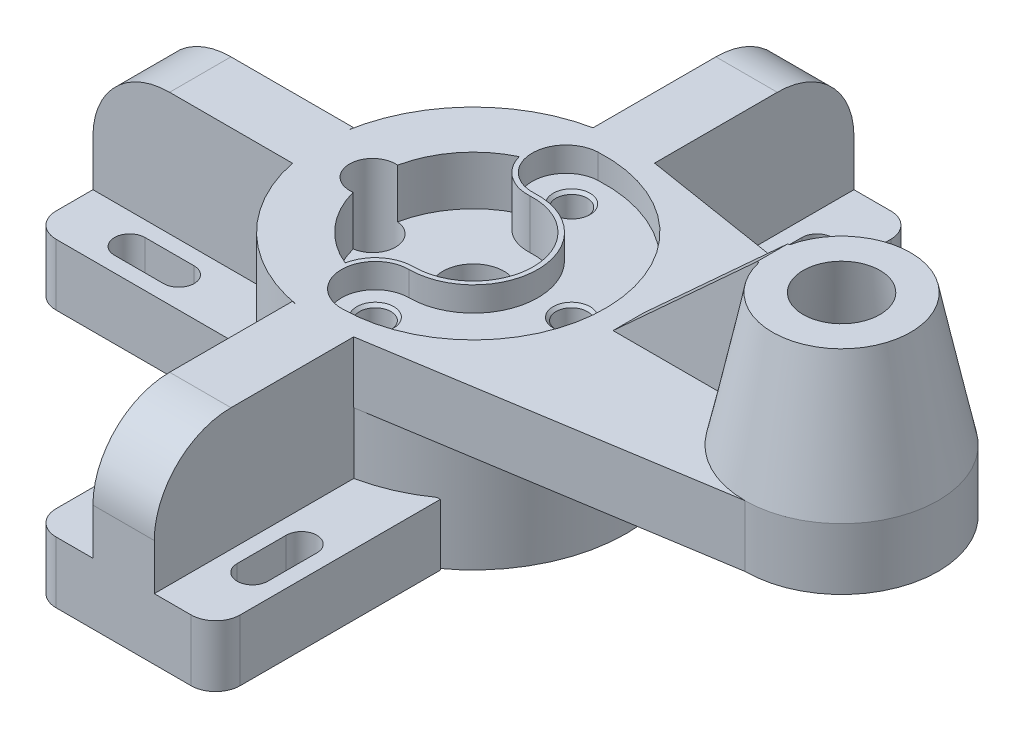
from build123d import *

# Parameters (mm, degrees)
BOSS_EXTRUDE1_DEPTH      = 20
BOSS_EXTRUDE2_START      = 40
SKETCH3_R                = 50
BOSS_EXTRUDE2_DEPTH      = 40
BOSS_EXTRUDE3_START      = -40
BOSS_EXTRUDE3_DEPTH      = 40
FILLET1_R                = 25
CIRPATTERN1_COUNT        = 2
CIRPATTERN1_ANGLE        = 90
FILLET1_OF_CIRPATTERN1_R = 25
CIRPATTERN2_COUNT        = 2
FILLET1_OF_CIRPATTERN2_R = 25
BOSS_EXTRUDE4_START      = 20
BOSS_EXTRUDE4_DEPTH      = 20
FILLET2_R                = 8
FILLET3_R                = 8
CUT_EXTRUDE1_DEPTH       = 264.396788984
CIRPATTERN4_COUNT        = 2
CIRPATTERN4_ANGLE        = 180
CIRPATTERN4_COPY_1_DEPTH = 264.396788984
FILLET4_R                = 8
FILLET5_R                = 8
CIRPATTERN6_COUNT        = 2
CIRPATTERN6_ANGLE        = 270
CIRPATTERN6_COPY_1_DEPTH = 264.396788984
FILLET6_R                = 8
FILLET7_R                = 8
CUT_EXTRUDE2_DEPTH       = 8
CIRPATTERN7_COUNT        = 3
CIRPATTERN7_ANGLE        = 180
CUT_EXTRUDE3_DEPTH       = 16
SKETCH21_R               = 7.5
CUT_EXTRUDE4_DEPTH       = 268.16636848
SKETCH22_R               = 10
CUT_EXTRUDE5_DEPTH       = 267.943567929


with BuildPart() as part:
    # Sketch2 → Boss-Extrude1 (new body)
    with BuildSketch(Plane(origin=(0, 0, 0), x_dir=(1, 0, 0), z_dir=(0, 1, 0))):
        with BuildLine():
            Line((-112.127978028, 49.376424233), (0, 31.5))
            ThreePointArc((0, 31.5), (31.5, 0), (0, -31.5))
            Line((0, -31.5), (-112.127978028, -49.376424233))
            ThreePointArc((-112.127978028, -49.376424233), (-170, 0), (-112.127978028, 49.376424233))
        make_face()
    extrude(amount=BOSS_EXTRUDE1_DEPTH)

    # Sketch3 → Boss-Extrude2 (add)
    with BuildSketch(Plane.XZ.offset(BOSS_EXTRUDE2_START)):
        with Locations(Location((-120, 0, 0), (0, 0, 270))):
            Circle(SKETCH3_R)
    extrude(amount=-BOSS_EXTRUDE2_DEPTH)

    # Sketch5 → Boss-Extrude3 (add)
    with BuildSketch(Plane(origin=(0, 20, 0), x_dir=(1, 0, 0), z_dir=(0, 1, 0)).offset(BOSS_EXTRUDE3_START)):
        with BuildLine():
            Line((-130, 114.03716334), (-130, 48.989794856))
            ThreePointArc((-130, 48.989794856), (-121.081407967, 49.9883042), (-112.127978028, 49.376424233))
            Line((-112.127978028, 49.376424233), (-110, 49.03716334))
            Line((-110, 49.03716334), (-110, 114.03716334))
            Line((-110, 114.03716334), (-130, 114.03716334))
        make_face()
    boss_extrude3 = extrude(amount=BOSS_EXTRUDE3_DEPTH)

    # Fillet1
    fillet1_edges = [part.edges().sort_by_distance(p)[0] for p in [
        (-120, 20, -114.03716334),
    ]]
    fillet(fillet1_edges, radius=FILLET1_R)

    # CirPattern1: Boss-Extrude3 ×2 about axis
    cirpattern1_axis = Axis((-120, 0, 0), (0, 1, 0))
    for i in range(1, CIRPATTERN1_COUNT):
        add(boss_extrude3.rotate(cirpattern1_axis, i * CIRPATTERN1_ANGLE / (CIRPATTERN1_COUNT - 1)))

    # Fillet1 of CirPattern1
    fillet1_of_cirpattern1_edges = [part.edges().sort_by_distance(p)[0] for p in [
        (-234.03716334, 20, 0),
    ]]
    fillet(fillet1_of_cirpattern1_edges, radius=FILLET1_OF_CIRPATTERN1_R)

    # CirPattern2: Boss-Extrude3 ×2 about axis
    cirpattern2_axis = Axis((-120, 0, 0), (0, 1, 0))
    for i in range(1, CIRPATTERN2_COUNT):
        add(boss_extrude3.rotate(cirpattern2_axis, i * 360 / CIRPATTERN2_COUNT))

    # Fillet1 of CirPattern2
    fillet1_of_cirpattern2_edges = [part.edges().sort_by_distance(p)[0] for p in [
        (-120, 20, 114.03716334),
    ]]
    fillet(fillet1_of_cirpattern2_edges, radius=FILLET1_OF_CIRPATTERN2_R)

    # Sketch6 → Boss-Extrude4 (add)
    with BuildSketch(Plane.XZ.offset(20).offset(BOSS_EXTRUDE4_START)):
        with BuildLine():
            ThreePointArc((-110, 48.989794856), (-100.123850776, 45.879610853), (-91.100082802, 40.801896842))
            Line((-91.100082802, 40.801896842), (-90, 40.801896842))
            Line((-90, 40.801896842), (-90, 114.03716334))
            Line((-90, 114.03716334), (-110, 114.03716334))
            Line((-110, 114.03716334), (-110, 48.989794856))
        make_face()
        with BuildLine():
            ThreePointArc((-120, 50), (-114.9745519, 49.74680765), (-110, 48.989794856))
            Line((-110, 48.989794856), (-110, 114.03716334))
            Line((-110, 114.03716334), (-120, 114.03716334))
            Line((-120, 114.03716334), (-120, 50))
        make_face()
        with BuildLine():
            Line((-130, 49.03716334), (-127.872021972, 49.376424233))
            ThreePointArc((-127.872021972, 49.376424233), (-123.948340685, 49.843862268), (-120, 50))
            Line((-120, 50), (-120, 114.03716334))
            Line((-120, 114.03716334), (-130, 114.03716334))
            Line((-130, 114.03716334), (-130, 49.03716334))
        make_face()
        with BuildLine():
            Line((-150, 40.801896842), (-148.899917198, 40.801896842))
            ThreePointArc((-148.899917198, 40.801896842), (-138.879208341, 46.298763401), (-127.872021972, 49.376424233))
            Line((-127.872021972, 49.376424233), (-130, 49.03716334))
            Line((-130, 49.03716334), (-130, 114.03716334))
            Line((-130, 114.03716334), (-150, 114.03716334))
            Line((-150, 114.03716334), (-150, 40.801896842))
        make_face()
    boss_extrude4 = extrude(amount=-BOSS_EXTRUDE4_DEPTH)

    # Fillet2
    fillet2_edges = [part.edges().sort_by_distance(p)[0] for p in [
        (-150, -30, 114.03716334),
    ]]
    fillet(fillet2_edges, radius=FILLET2_R)

    # Fillet3
    fillet3_edges = [part.edges().sort_by_distance(p)[0] for p in [
        (-90, -30, 114.03716334),
    ]]
    fillet(fillet3_edges, radius=FILLET3_R)

    # Sketch8 → Cut-Extrude1 (cut, through all)
    with BuildSketch(Plane(origin=(0, -20, 0), x_dir=(1, 0, 0), z_dir=(0, 1, 0))):
        with BuildLine():
            Line((-95, -76.03716334), (-95, -92.03716334))
            ThreePointArc((-95, -92.03716334), (-100, -97.03716334), (-105, -92.03716334))
            Line((-105, -92.03716334), (-105, -76.03716334))
            ThreePointArc((-105, -76.03716334), (-100, -71.03716334), (-95, -76.03716334))
        make_face()
    cut_extrude1 = extrude(amount=-CUT_EXTRUDE1_DEPTH, mode=Mode.SUBTRACT)

    # Mirror1: Cut-Extrude1 across plane
    add(cut_extrude1.mirror(Plane(origin=(-120, 0, 0), x_dir=(0, 0, 1), z_dir=(1, 0, 0))), mode=Mode.SUBTRACT)

    # CirPattern4: Boss-Extrude4, Cut-Extrude1 ×2 about axis
    cirpattern4_axis = Axis((-120, 0, 0), (0, 1, 0))
    add([boss_extrude4.rotate(cirpattern4_axis, i * CIRPATTERN4_ANGLE / (CIRPATTERN4_COUNT - 1)) for i in range(1, CIRPATTERN4_COUNT)])
    add([cut_extrude1.rotate(cirpattern4_axis, i * CIRPATTERN4_ANGLE / (CIRPATTERN4_COUNT - 1)) for i in range(1, CIRPATTERN4_COUNT)], mode=Mode.SUBTRACT)

    # CirPattern4 copy 1 sketch → CirPattern4 copy 1 (cut, through all)
    with BuildSketch(Plane(origin=(0, -20, 0), x_dir=(1, 0, 0), z_dir=(0, 1, 0))):
        with BuildLine():
            Line((-95, 76.03716334), (-95, 92.03716334))
            ThreePointArc((-95, 92.03716334), (-100, 97.03716334), (-105, 92.03716334))
            Line((-105, 92.03716334), (-105, 76.03716334))
            ThreePointArc((-105, 76.03716334), (-100, 71.03716334), (-95, 76.03716334))
        make_face()
    extrude(amount=-CIRPATTERN4_COPY_1_DEPTH, mode=Mode.SUBTRACT)

    # Fillet4
    fillet4_edges = [part.edges().sort_by_distance(p)[0] for p in [
        (-90, -30, -114.03716334),
    ]]
    fillet(fillet4_edges, radius=FILLET4_R)

    # Fillet5
    fillet5_edges = [part.edges().sort_by_distance(p)[0] for p in [
        (-150, -30, -114.03716334),
    ]]
    fillet(fillet5_edges, radius=FILLET5_R)

    # CirPattern6: Boss-Extrude4, Cut-Extrude1 ×2 about axis
    cirpattern6_axis = Axis((-120, 0, 0), (0, 1, 0))
    add([boss_extrude4.rotate(cirpattern6_axis, i * CIRPATTERN6_ANGLE / (CIRPATTERN6_COUNT - 1)) for i in range(1, CIRPATTERN6_COUNT)])
    add([cut_extrude1.rotate(cirpattern6_axis, i * CIRPATTERN6_ANGLE / (CIRPATTERN6_COUNT - 1)) for i in range(1, CIRPATTERN6_COUNT)], mode=Mode.SUBTRACT)

    # CirPattern6 copy 1 sketch → CirPattern6 copy 1 (cut, through all)
    with BuildSketch(Plane(origin=(-120, -20, -120), x_dir=(0, 0, -1), z_dir=(0, 1, 0))):
        with BuildLine():
            Line((-95, 76.03716334), (-95, 92.03716334))
            ThreePointArc((-95, 92.03716334), (-100, 97.03716334), (-105, 92.03716334))
            Line((-105, 92.03716334), (-105, 76.03716334))
            ThreePointArc((-105, 76.03716334), (-100, 71.03716334), (-95, 76.03716334))
        make_face()
    extrude(amount=-CIRPATTERN6_COPY_1_DEPTH, mode=Mode.SUBTRACT)

    # Fillet6
    fillet6_edges = [part.edges().sort_by_distance(p)[0] for p in [
        (-234.03716334, -30, 30),
    ]]
    fillet(fillet6_edges, radius=FILLET6_R)

    # Fillet7
    fillet7_edges = [part.edges().sort_by_distance(p)[0] for p in [
        (-234.03716334, -30, -30),
    ]]
    fillet(fillet7_edges, radius=FILLET7_R)

    # Sketch10 → Revolve1 (revolve)
    with BuildSketch(Plane.XY, mode=Mode.PRIVATE) as revolve1_sk:
        Polygon((31.5, 20), (22.5, 63), (0, 63), (0, 20), align=None)
    revolve(revolve1_sk.sketch.rotate(Axis((0, 0, 0), (0, 1, 0)), 90), axis=Axis((0, 0, 0), (0, 1, 0)))

    # Sketch11 → Cut-Revolve1 (revolve, cut)
    with BuildSketch(Plane.XY, mode=Mode.PRIVATE) as cut_revolve1_sk:
        Polygon((0, 63), (0, 0), (22.5, 0), (12.5, 63), align=None)
    revolve(cut_revolve1_sk.sketch.rotate(Axis((0, 82.375246711, 0), (0, -1, 0)), 90), axis=Axis((0, 82.375246711, 0), (0, -1, 0)), mode=Mode.SUBTRACT)

    # Rib6: read off the stored shape, not the designer's step
    # Rib6: loft between two sections, ruled curve by curve
    rib6_from = [
        Edge.make_line((-69.5, 20, 5), (-31.10064308, 20, 5)),
        Edge.make_line((-31.10064308, 20, -5), (-69.5, 20, -5)),
        Edge.make_line((-69.5, 20, -5), (-69.5, 20, 5)),
        Edge.make_line((-31.10064308, 20, -5), (-31.10064308, 20, 5)),
    ]
    rib6_to = [
        Edge.make_line((-22.5, 63, 5), (-21.937410968, 63, 5)),
        Edge.make_line((-21.937410968, 63, -5), (-22.5, 63, -5)),
        Edge.make_line((-22.5, 63, -5), (-22.5, 63, 5)),
        Edge.make_line((-21.937410968, 63, -5), (-21.937410968, 63, 5)),
    ]
    rib6 = Solid(Shell([*[Face.make_surface_from_curves(rib6_from[k], rib6_to[k]) for k in range(4)], Face(Wire(rib6_from)), Face(Wire(rib6_to))]))
    add(rib6)

    # Sketch15 → Cut-Extrude2 (cut)
    with BuildSketch(Plane(origin=(0, 20, 0), x_dir=(1, 0, 0), z_dir=(0, 1, 0))):
        with BuildLine():
            ThreePointArc((-120, -43), (-77.016651718, 1.196566115), (-122.392205492, 42.933406025))
            ThreePointArc((-122.392205492, 42.933406025), (-132.763210279, 31.338482148), (-121.168286403, 20.967477361))
            ThreePointArc((-121.168286403, 20.967477361), (-99.008132234, 0.584369498), (-120, -21))
            ThreePointArc((-120, -21), (-131, -32), (-120, -43))
        make_face()
    extrude(amount=-CUT_EXTRUDE2_DEPTH, mode=Mode.SUBTRACT)

    # Sketch19 → M12 Tapped Hole1 (revolve, cut)
    with BuildSketch(Plane(origin=(-120, 12, 32), x_dir=(0, 0, 1), z_dir=(1, 0, 0))):
        Polygon((0, 0), (0, 28.064389157), (5.1, 25), (5.1, 0.925), (6.025, 0), align=None)
    m12_tapped_hole1 = revolve(axis=Axis((-120, 18.35, 32), (0, -1, 0)), mode=Mode.SUBTRACT)

    # CirPattern7: M12 Tapped Hole1 ×3 about axis
    cirpattern7_axis = Axis((-120, 0, 0), (0, 1, 0))
    for i in range(1, CIRPATTERN7_COUNT):
        add(m12_tapped_hole1.rotate(cirpattern7_axis, i * CIRPATTERN7_ANGLE / (CIRPATTERN7_COUNT - 1)), mode=Mode.SUBTRACT)

    # Sketch20 → Cut-Extrude3 (cut)
    with BuildSketch(Plane(origin=(0, 20, 0), x_dir=(1, 0, 0), z_dir=(0, 1, 0))):
        with BuildLine():
            ThreePointArc((-133.884701329, 28.8308007), (-151.987608024, -0.890467807), (-132.259263254, -29.55859375))
            ThreePointArc((-132.259263254, -29.55859375), (-127.928821535, -22.33647119), (-120, -19.5))
            ThreePointArc((-120, -19.5), (-100.50755136, 0.54262882), (-121.084837374, 19.469800407))
            ThreePointArc((-121.084837374, 19.469800407), (-129.159180077, 21.860777124), (-133.884701329, 28.8308007))
        make_face()
    extrude(amount=-CUT_EXTRUDE3_DEPTH, mode=Mode.SUBTRACT)

    # Sketch21 → Cut-Extrude4 (cut, through all)
    with BuildSketch(Plane(origin=(0, 20, 0), x_dir=(1, 0, 0), z_dir=(0, 1, 0))):
        with Locations(Location((-151.987608024, -0.890467807, 0), (0, 0, 270))):
            Circle(SKETCH21_R)
    extrude(amount=-CUT_EXTRUDE4_DEPTH, mode=Mode.SUBTRACT)

    # Sketch22 → Cut-Extrude5 (cut, through all)
    with BuildSketch(Plane(origin=(0, 4, 0), x_dir=(1, 0, 0), z_dir=(0, 1, 0))):
        with Locations(Location((-120, 0, 0), (0, 0, 270))):
            Circle(SKETCH22_R)
    extrude(amount=-CUT_EXTRUDE5_DEPTH, mode=Mode.SUBTRACT)


solid = part.part
